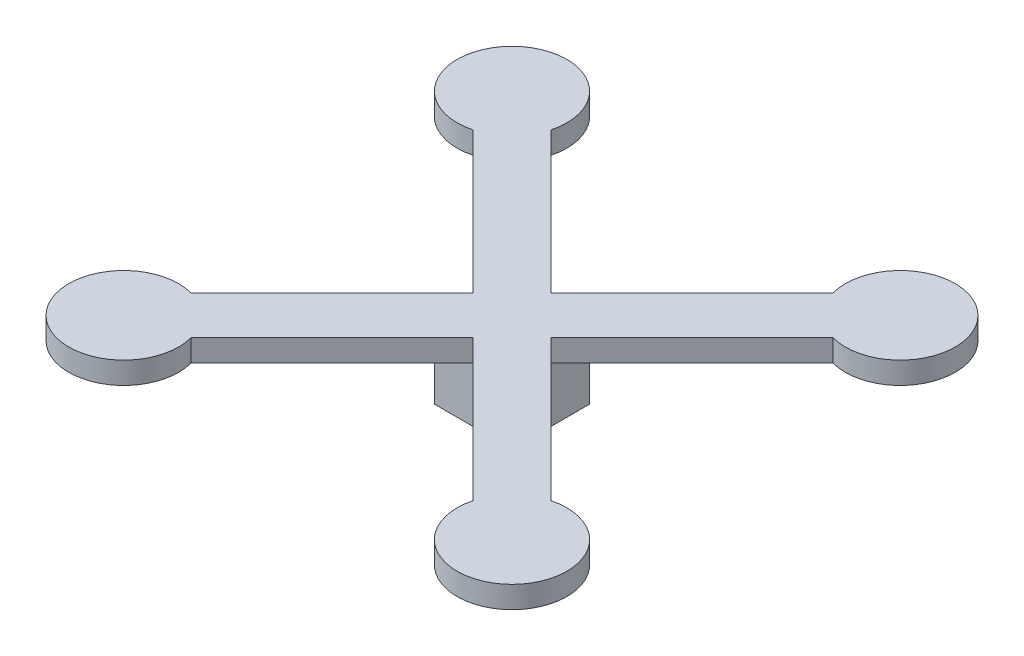
from build123d import *

# Parameters (mm, degrees)
BOSS_EXTRUDE1_DEPTH = 20
SKETCH2_W           = 70.710678118
SKETCH2_H           = 70.710678118
BOSS_EXTRUDE2_DEPTH = 50


with BuildPart() as part:
    # Sketch1 → Boss-Extrude1 (new body)
    with BuildSketch(Plane(origin=(0, 0, 0), x_dir=(1, 0, 0), z_dir=(0, 1, 0))):
        with BuildLine():
            Line((-163.835743042, 128.480403982), (-35.355339059, 0))
            Line((-35.355339059, 0), (-163.835743042, -128.480403982))
            ThreePointArc((-163.835743042, -128.480403982), (-212.132034356, -212.132034356), (-128.480403982, -163.835743042))
            Line((-128.480403982, -163.835743042), (0, -35.355339059))
            Line((0, -35.355339059), (128.480403982, -163.835743042))
            ThreePointArc((128.480403982, -163.835743042), (212.132034356, -212.132034356), (163.835743042, -128.480403982))
            Line((163.835743042, -128.480403982), (35.355339059, 0))
            Line((35.355339059, 0), (163.835743042, 128.480403982))
            ThreePointArc((163.835743042, 128.480403982), (212.132034356, 212.132034356), (128.480403982, 163.835743042))
            Line((128.480403982, 163.835743042), (0, 35.355339059))
            Line((0, 35.355339059), (-128.480403982, 163.835743042))
            ThreePointArc((-128.480403982, 163.835743042), (-212.132034356, 212.132034356), (-163.835743042, 128.480403982))
        make_face()
    extrude(amount=BOSS_EXTRUDE1_DEPTH)

    # Sketch2 → Boss-Extrude2 (add)
    with BuildSketch(Plane.XZ):
        Rectangle(SKETCH2_W, SKETCH2_H)
    extrude(amount=BOSS_EXTRUDE2_DEPTH)


solid = part.part
